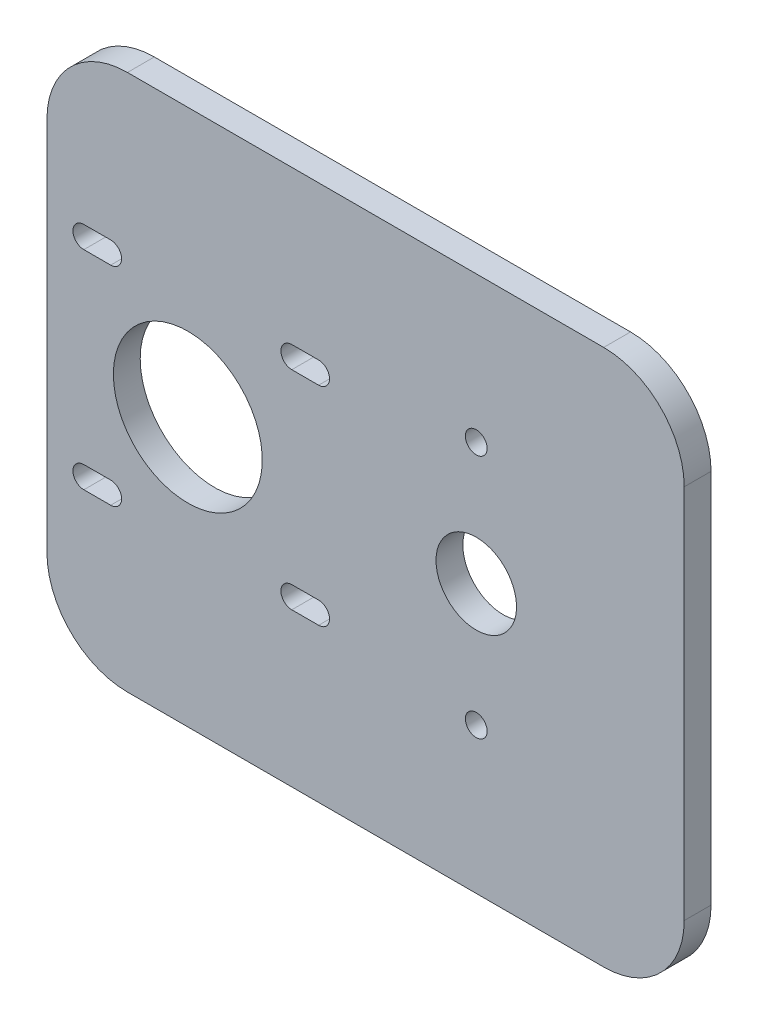
from build123d import *

# Parameters (mm, degrees)
CROQUIS1_W              = 95
CROQUIS1_H              = 80
SALIENTE_EXTRUIR1_DEPTH = 4
CROQUIS2_R              = 11.1
CROQUIS2_R_2            = 6
CROQUIS2_R_3            = 1.625
CORTAR_EXTRUIR1_DEPTH   = 125.261820363
REDONDEO1_R             = 12


with BuildPart() as part:
    # Croquis1 → Saliente-Extruir1 (new body)
    with BuildSketch(Plane.XY):
        with Locations((47.5, 40)):
            Rectangle(CROQUIS1_W, CROQUIS1_H)
    extrude(amount=SALIENTE_EXTRUIR1_DEPTH)

    # Croquis2 → Cortar-Extruir1 (cut, through all)
    with BuildSketch(Plane(origin=(0, 0, 0), x_dir=(-1, 0, 0), z_dir=(0, 0, -1))):
        with Locations((-21, 40)):
            Circle(CROQUIS2_R)
        with Locations((-64, 40)):
            Circle(CROQUIS2_R_2)
        with Locations((-64, 21.75)):
            Circle(CROQUIS2_R_3)
        with Locations((-64, 58.25)):
            Circle(CROQUIS2_R_3)
        with BuildLine():
            Line((-36.5, 53.875), (-40.5, 53.875))
            ThreePointArc((-40.5, 53.875), (-42.125, 55.5), (-40.5, 57.125))
            Line((-40.5, 57.125), (-36.5, 57.125))
            ThreePointArc((-36.5, 57.125), (-34.875, 55.5), (-36.5, 53.875))
        make_face()
        with BuildLine():
            Line((-36.5, 22.875), (-40.5, 22.875))
            ThreePointArc((-40.5, 22.875), (-42.125, 24.5), (-40.5, 26.125))
            Line((-40.5, 26.125), (-36.5, 26.125))
            ThreePointArc((-36.5, 26.125), (-34.875, 24.5), (-36.5, 22.875))
        make_face()
        with BuildLine():
            Line((-5.5, 22.875), (-9.5, 22.875))
            ThreePointArc((-9.5, 22.875), (-11.125, 24.5), (-9.5, 26.125))
            Line((-9.5, 26.125), (-5.5, 26.125))
            ThreePointArc((-5.5, 26.125), (-3.875, 24.5), (-5.5, 22.875))
        make_face()
        with BuildLine():
            Line((-5.5, 53.875), (-9.5, 53.875))
            ThreePointArc((-9.5, 53.875), (-11.125, 55.5), (-9.5, 57.125))
            Line((-9.5, 57.125), (-5.5, 57.125))
            ThreePointArc((-5.5, 57.125), (-3.875, 55.5), (-5.5, 53.875))
        make_face()
    extrude(amount=-CORTAR_EXTRUIR1_DEPTH, mode=Mode.SUBTRACT)

    # Redondeo1
    redondeo1_edges = [part.edges().sort_by_distance(p)[0] for p in [
        (95, 0, 2),
        (95, 80, 2),
        (0, 0, 2),
        (0, 80, 2),
    ]]
    fillet(redondeo1_edges, radius=REDONDEO1_R)


solid = part.part
